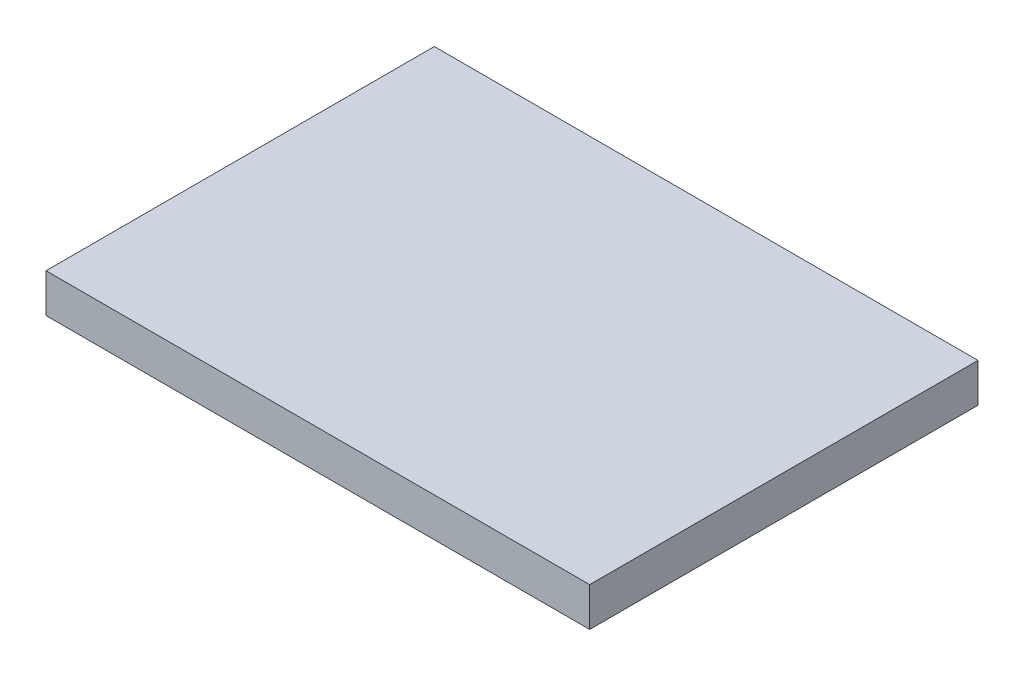
from build123d import *

# Parameters (mm, degrees)
SKETCH1_W           = 177.8
SKETCH1_H           = 127
BOSS_EXTRUDE1_DEPTH = 12.7


with BuildPart() as part:
    # Sketch1 → Boss-Extrude1 (new body)
    with BuildSketch(Plane(origin=(0, 0, 0), x_dir=(1, 0, 0), z_dir=(0, 1, 0))):
        Rectangle(SKETCH1_W, SKETCH1_H)
    extrude(amount=BOSS_EXTRUDE1_DEPTH)


solid = part.part
